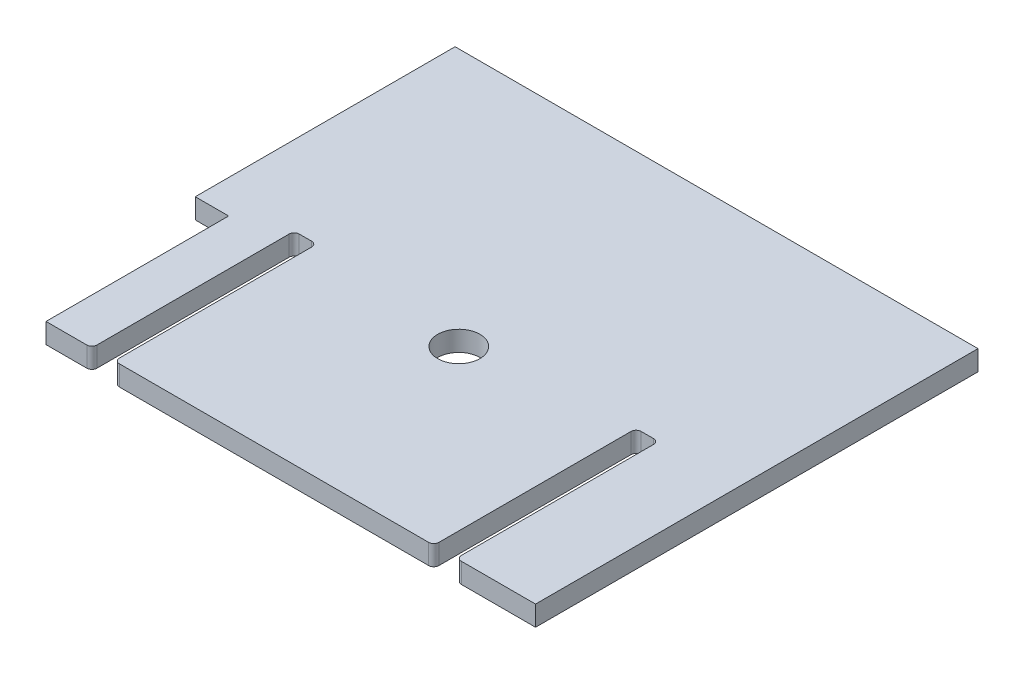
from build123d import *

# Parameters (mm, degrees)
BOSS_EXTRUDE1_DEPTH  = 12.7
CAVITY1_START        = 298.45
CAVITY1_OUTLINE_R    = 12.7
CAVITY1_DEPTH        = 12.7
CAVITY1_START_2      = 720.91620239
CAVITY1_2_DEPTH      = 22.43918751
SKETCH2_W            = 21.068746236
SKETCH2_H            = 115.32536453
CUT_EXTRUDE1_DEPTH   = 1143.349273427
MOVE_FACE_SLOTS_BY   = 0.762
MOVE_FACE_SLOTS_2_BY = 0.762
MOVE_FACE_SLOTS_3_BY = 0.762
MOVE_FACE_SLOTS_4_BY = 0.762
MOVE_FACE_SLOTS_5_BY = 0.762
MOVE_FACE_SLOTS_6_BY = 0.762
MOVE_FACE_HOLES_BY   = 0.635
SLOT_FILLETS_R       = 3.175


# Read off the part's stored shape, not the designer's step: Cavity1
with BuildPart() as part:
    # Sketch1 → Boss-Extrude1 (new body)
    with BuildSketch(Plane(origin=(0, 298.45, 0), x_dir=(-1, 0, 0), z_dir=(0, -1, 0))):
        Polygon((-798.4, 260.35), (-798.4, 133.35), (-1001.6, 133.35), (-1001.6, 260.35), (-1014.3, 260.35), (-1014.3, 133.35), (-1065.1, 133.35), (-1065.1, 412.75), (-1014.3, 412.75), (-1001.6, 412.75), (-798.4, 412.75), (-785.7, 412.75), (-734.9, 412.75), (-734.9, 133.35), (-785.7, 133.35), (-785.7, 260.35), align=None)
    extrude(amount=-BOSS_EXTRUDE1_DEPTH)

    # Cavity1 outline → Cavity1 (cut)
    with BuildSketch(Plane(origin=(0, 0, 0), x_dir=(1, 0, 0), z_dir=(0, 1, 0)).offset(CAVITY1_START)):
        with Locations((900, 250)):
            Circle(CAVITY1_OUTLINE_R)
    extrude(amount=CAVITY1_DEPTH, mode=Mode.SUBTRACT)

    # Cavity1 2 outline → Cavity1 2 (cut)
    with BuildSketch(Plane(origin=(0, 0, 0), x_dir=(0.7149295353100682, -0.6987525164445135, -0.024913456279483565), z_dir=(0.6991965099607762, 0.7144755512387232, 0.02547404837855681)).offset(CAVITY1_START_2)):
        with BuildLine():
            ThreePointArc((313.444242413, 230.081087528), (327.146171675, 242.424687318), (314.076314529, 255.435688643))
            Line((314.076314529, 255.435688643), (312, 255.374549574))
            Line((312, 255.374549574), (312, 230.195835843))
            Line((312, 230.195835843), (313.444242413, 230.081087528))
        make_face()
    extrude(amount=CAVITY1_2_DEPTH, mode=Mode.SUBTRACT)

    # Sketch2 → Cut-Extrude1 (cut, through all)
    with BuildSketch(Plane(origin=(0, 311.15, 0), x_dir=(1, 0, 0), z_dir=(0, 1, 0))):
        with Locations((745.434373118, 191.012682265)):
            Rectangle(SKETCH2_W, SKETCH2_H)
    extrude(amount=-CUT_EXTRUDE1_DEPTH, mode=Mode.SUBTRACT)

    # Move Face Slots: a face moved inward by 0.762
    extrude(part.faces().sort_by_distance((1001.6, 304.8, -196.85))[0], amount=MOVE_FACE_SLOTS_BY, dir=(-1, 0, 0), mode=Mode.SUBTRACT)

    # Move Face Slots 2: a face moved inward by 0.762
    extrude(part.faces().sort_by_distance((785.7, 304.8, -196.85))[0], amount=MOVE_FACE_SLOTS_2_BY, dir=(-1, 0, 0), mode=Mode.SUBTRACT)

    # Move Face Slots 3: a face moved inward by 0.762
    extrude(part.faces().sort_by_distance((1014.3, 304.8, -196.85))[0], amount=MOVE_FACE_SLOTS_3_BY, dir=(1, 0, 0), mode=Mode.SUBTRACT)

    # Move Face Slots 4: a face moved inward by 0.762
    extrude(part.faces().sort_by_distance((1007.95, 304.8, -260.35))[0], amount=MOVE_FACE_SLOTS_4_BY, dir=(0, 0, -1), mode=Mode.SUBTRACT)

    # Move Face Slots 5: a face moved inward by 0.762
    extrude(part.faces().sort_by_distance((798.4, 304.8, -196.85))[0], amount=MOVE_FACE_SLOTS_5_BY, dir=(1, 0, 0), mode=Mode.SUBTRACT)

    # Move Face Slots 6: a face moved inward by 0.762
    extrude(part.faces().sort_by_distance((792.05, 304.8, -260.35))[0], amount=MOVE_FACE_SLOTS_6_BY, dir=(0, 0, -1), mode=Mode.SUBTRACT)

    # Move Face Holes: a curved face moved inward by 0.635
    add(Solid.thicken(part.faces().sort_by_distance((887.3, 304.8, -250))[0], -MOVE_FACE_HOLES_BY), mode=Mode.SUBTRACT)

    # Slot Fillets
    slot_fillets_edges = [part.edges().sort_by_distance(p)[0] for p in [
        (799.162, 304.8, -261.112),
        (799.162, 304.8, -133.35),
        (1000.838, 304.8, -133.35),
        (1000.838, 304.8, -261.112),
        (1015.062, 304.8, -261.112),
        (1015.062, 304.8, -133.35),
        (784.938, 304.8, -133.35),
        (784.938, 304.8, -261.112),
    ]]
    fillet(slot_fillets_edges, radius=SLOT_FILLETS_R)


solid = part.part
